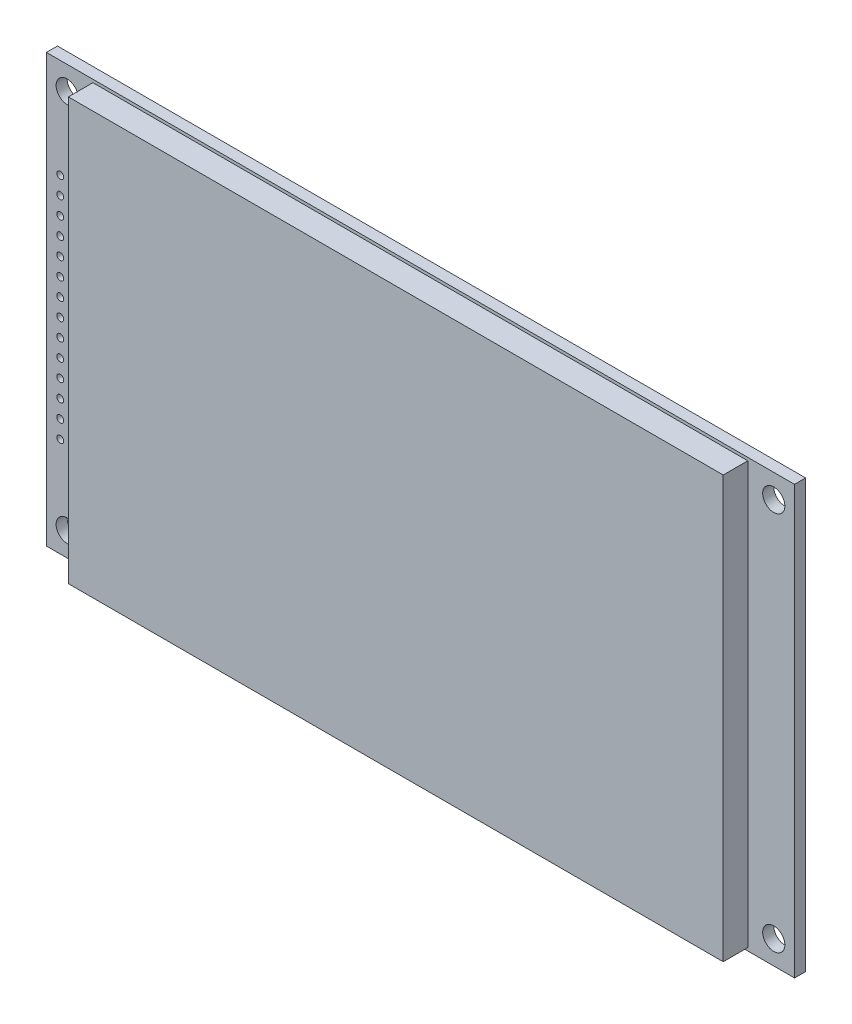
from build123d import *
from build123d.topology import SkipClean

# Parameters (mm, degrees)
SKETCH1_W              = 108.04
SKETCH1_H              = 61.74
SKETCH1_R              = 1.6
BOSS_EXTRUDE1_DEPTH    = 1.6
SKETCH2_W              = 94.57
SKETCH2_H              = 60.88
BOSS_EXTRUDE2_DEPTH    = 3.55
SKETCH3_R              = 0.5
CUT_EXTRUDE1_DEPTH     = 3.55
SKETCH4_W              = 2
SKETCH4_H              = 35.02
SKETCH4_R              = 0.5
BOSS_EXTRUDE3_DEPTH    = 2.5
SKETCH5_R              = 0.5
BOSS_EXTRUDE4_DEPTH    = 5.84
BOSS_EXTRUDE4_2_DEPTH  = 5.84
BOSS_EXTRUDE4_3_DEPTH  = 5.84
BOSS_EXTRUDE4_4_DEPTH  = 5.84
BOSS_EXTRUDE4_5_DEPTH  = 5.84
BOSS_EXTRUDE4_6_DEPTH  = 5.84
BOSS_EXTRUDE4_7_DEPTH  = 5.84
BOSS_EXTRUDE4_8_DEPTH  = 5.84
BOSS_EXTRUDE4_9_DEPTH  = 5.84
BOSS_EXTRUDE4_10_DEPTH = 5.84
BOSS_EXTRUDE4_11_DEPTH = 5.84
BOSS_EXTRUDE4_12_DEPTH = 5.84
BOSS_EXTRUDE4_13_DEPTH = 5.84
BOSS_EXTRUDE4_14_DEPTH = 5.84


with BuildPart() as part:
    # Sketch1 → Boss-Extrude1 (new body)
    with BuildSketch(Plane.XY):
        Rectangle(SKETCH1_W, SKETCH1_H)
        with Locations((-51.02, 27.45)):
            Circle(SKETCH1_R, mode=Mode.SUBTRACT)
        with Locations((-51.02, -27.45)):
            Circle(SKETCH1_R, mode=Mode.SUBTRACT)
        with Locations((51.02, -27.45)):
            Circle(SKETCH1_R, mode=Mode.SUBTRACT)
        with Locations((51.02, 27.45)):
            Circle(SKETCH1_R, mode=Mode.SUBTRACT)
    extrude(amount=BOSS_EXTRUDE1_DEPTH)

    # Sketch2 → Boss-Extrude2 (add)
    with BuildSketch(Plane.XY.offset(1.6)):
        with Locations((-0.015, 0)):
            Rectangle(SKETCH2_W, SKETCH2_H)
    extrude(amount=BOSS_EXTRUDE2_DEPTH)

    # Sketch3 → Cut-Extrude1 (cut)
    with BuildSketch(Plane.XY.offset(1.6)):
        with Locations((-52.02, 16.51)):
            Circle(SKETCH3_R)
        with Locations((-52.02, 13.97)):
            Circle(SKETCH3_R)
        with Locations((-52.02, 11.43)):
            Circle(SKETCH3_R)
        with Locations((-52.02, 8.89)):
            Circle(SKETCH3_R)
        with Locations((-52.02, 6.35)):
            Circle(SKETCH3_R)
        with Locations((-52.02, 3.81)):
            Circle(SKETCH3_R)
        with Locations((-52.02, 1.27)):
            Circle(SKETCH3_R)
        with Locations((-52.02, -1.27)):
            Circle(SKETCH3_R)
        with Locations((-52.02, -3.81)):
            Circle(SKETCH3_R)
        with Locations((-52.02, -6.35)):
            Circle(SKETCH3_R)
        with Locations((-52.02, -8.89)):
            Circle(SKETCH3_R)
        with Locations((-52.02, -11.43)):
            Circle(SKETCH3_R)
        with Locations((-52.02, -13.97)):
            Circle(SKETCH3_R)
        with Locations((-52.02, -16.51)):
            Circle(SKETCH3_R)
    extrude(amount=-CUT_EXTRUDE1_DEPTH, mode=Mode.SUBTRACT)

    # Sketch4 → Boss-Extrude3 (add)
    with SkipClean():  # the faces are left unmerged after this step: merging them gives an invalid solid
        with BuildSketch(Plane(origin=(0, 0, 0), x_dir=(-1, 0, 0), z_dir=(0, 0, -1))):
            with Locations((52.02, 0)):
                Rectangle(SKETCH4_W, SKETCH4_H)
            with Locations((52.02, -16.51)):
                Circle(SKETCH4_R, mode=Mode.SUBTRACT)
            with Locations((52.02, -13.97)):
                Circle(SKETCH4_R, mode=Mode.SUBTRACT)
            with Locations((52.02, -11.43)):
                Circle(SKETCH4_R, mode=Mode.SUBTRACT)
            with Locations((52.02, -8.89)):
                Circle(SKETCH4_R, mode=Mode.SUBTRACT)
            with Locations((52.02, -6.35)):
                Circle(SKETCH4_R, mode=Mode.SUBTRACT)
            with Locations((52.02, -3.81)):
                Circle(SKETCH4_R, mode=Mode.SUBTRACT)
            with Locations((52.02, -1.27)):
                Circle(SKETCH4_R, mode=Mode.SUBTRACT)
            with Locations((52.02, 1.27)):
                Circle(SKETCH4_R, mode=Mode.SUBTRACT)
            with Locations((52.02, 3.81)):
                Circle(SKETCH4_R, mode=Mode.SUBTRACT)
            with Locations((52.02, 6.35)):
                Circle(SKETCH4_R, mode=Mode.SUBTRACT)
            with Locations((52.02, 8.89)):
                Circle(SKETCH4_R, mode=Mode.SUBTRACT)
            with Locations((52.02, 11.43)):
                Circle(SKETCH4_R, mode=Mode.SUBTRACT)
            with Locations((52.02, 13.97)):
                Circle(SKETCH4_R, mode=Mode.SUBTRACT)
            with Locations((52.02, 16.51)):
                Circle(SKETCH4_R, mode=Mode.SUBTRACT)
        extrude(amount=BOSS_EXTRUDE3_DEPTH)


with BuildPart() as body_2:
    # Sketch5 → Boss-Extrude4 (new body)
    with BuildSketch(Plane(origin=(0, 0, -2.5), x_dir=(-1, 0, 0), z_dir=(0, 0, -1))):
        with Locations((52.02, -16.51)):
            Circle(SKETCH5_R)
    extrude(amount=BOSS_EXTRUDE4_DEPTH)


with BuildPart() as body_3:
    # Sketch5 → Boss-Extrude4 2 (new body)
    with BuildSketch(Plane(origin=(0, 0, -2.5), x_dir=(-1, 0, 0), z_dir=(0, 0, -1))):
        with Locations((52.02, -13.97)):
            Circle(SKETCH5_R)
    extrude(amount=BOSS_EXTRUDE4_2_DEPTH)


with BuildPart() as body_4:
    # Sketch5 → Boss-Extrude4 3 (new body)
    with BuildSketch(Plane(origin=(0, 0, -2.5), x_dir=(-1, 0, 0), z_dir=(0, 0, -1))):
        with Locations((52.02, -11.43)):
            Circle(SKETCH5_R)
    extrude(amount=BOSS_EXTRUDE4_3_DEPTH)


with BuildPart() as body_5:
    # Sketch5 → Boss-Extrude4 4 (new body)
    with BuildSketch(Plane(origin=(0, 0, -2.5), x_dir=(-1, 0, 0), z_dir=(0, 0, -1))):
        with Locations((52.02, -8.89)):
            Circle(SKETCH5_R)
    extrude(amount=BOSS_EXTRUDE4_4_DEPTH)


with BuildPart() as body_6:
    # Sketch5 → Boss-Extrude4 5 (new body)
    with BuildSketch(Plane(origin=(0, 0, -2.5), x_dir=(-1, 0, 0), z_dir=(0, 0, -1))):
        with Locations((52.02, -6.35)):
            Circle(SKETCH5_R)
    extrude(amount=BOSS_EXTRUDE4_5_DEPTH)


with BuildPart() as body_7:
    # Sketch5 → Boss-Extrude4 6 (new body)
    with BuildSketch(Plane(origin=(0, 0, -2.5), x_dir=(-1, 0, 0), z_dir=(0, 0, -1))):
        with Locations((52.02, -3.81)):
            Circle(SKETCH5_R)
    extrude(amount=BOSS_EXTRUDE4_6_DEPTH)


with BuildPart() as body_8:
    # Sketch5 → Boss-Extrude4 7 (new body)
    with BuildSketch(Plane(origin=(0, 0, -2.5), x_dir=(-1, 0, 0), z_dir=(0, 0, -1))):
        with Locations((52.02, -1.27)):
            Circle(SKETCH5_R)
    extrude(amount=BOSS_EXTRUDE4_7_DEPTH)


with BuildPart() as body_9:
    # Sketch5 → Boss-Extrude4 8 (new body)
    with BuildSketch(Plane(origin=(0, 0, -2.5), x_dir=(-1, 0, 0), z_dir=(0, 0, -1))):
        with Locations((52.02, 1.27)):
            Circle(SKETCH5_R)
    extrude(amount=BOSS_EXTRUDE4_8_DEPTH)


with BuildPart() as body_10:
    # Sketch5 → Boss-Extrude4 9 (new body)
    with BuildSketch(Plane(origin=(0, 0, -2.5), x_dir=(-1, 0, 0), z_dir=(0, 0, -1))):
        with Locations((52.02, 3.81)):
            Circle(SKETCH5_R)
    extrude(amount=BOSS_EXTRUDE4_9_DEPTH)


with BuildPart() as body_11:
    # Sketch5 → Boss-Extrude4 10 (new body)
    with BuildSketch(Plane(origin=(0, 0, -2.5), x_dir=(-1, 0, 0), z_dir=(0, 0, -1))):
        with Locations((52.02, 6.35)):
            Circle(SKETCH5_R)
    extrude(amount=BOSS_EXTRUDE4_10_DEPTH)


with BuildPart() as body_12:
    # Sketch5 → Boss-Extrude4 11 (new body)
    with BuildSketch(Plane(origin=(0, 0, -2.5), x_dir=(-1, 0, 0), z_dir=(0, 0, -1))):
        with Locations((52.02, 8.89)):
            Circle(SKETCH5_R)
    extrude(amount=BOSS_EXTRUDE4_11_DEPTH)


with BuildPart() as body_13:
    # Sketch5 → Boss-Extrude4 12 (new body)
    with BuildSketch(Plane(origin=(0, 0, -2.5), x_dir=(-1, 0, 0), z_dir=(0, 0, -1))):
        with Locations((52.02, 11.43)):
            Circle(SKETCH5_R)
    extrude(amount=BOSS_EXTRUDE4_12_DEPTH)


with BuildPart() as body_14:
    # Sketch5 → Boss-Extrude4 13 (new body)
    with BuildSketch(Plane(origin=(0, 0, -2.5), x_dir=(-1, 0, 0), z_dir=(0, 0, -1))):
        with Locations((52.02, 13.97)):
            Circle(SKETCH5_R)
    extrude(amount=BOSS_EXTRUDE4_13_DEPTH)


with BuildPart() as body_15:
    # Sketch5 → Boss-Extrude4 14 (new body)
    with BuildSketch(Plane(origin=(0, 0, -2.5), x_dir=(-1, 0, 0), z_dir=(0, 0, -1))):
        with Locations((52.02, 16.51)):
            Circle(SKETCH5_R)
    extrude(amount=BOSS_EXTRUDE4_14_DEPTH)


solid = Compound([part.part, body_2.part, body_3.part, body_4.part, body_5.part, body_6.part, body_7.part, body_8.part, body_9.part, body_10.part, body_11.part, body_12.part, body_13.part, body_14.part, body_15.part])
